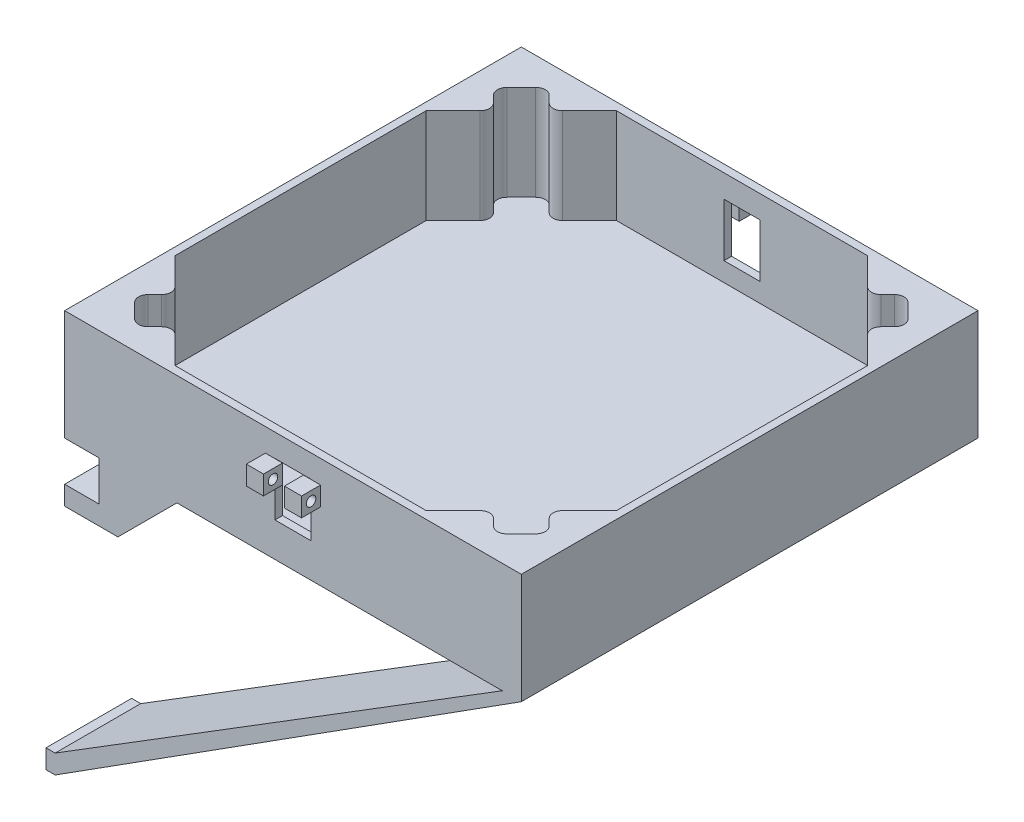
from build123d import *

# Parameters (mm, degrees)
SZKIC1_W                        = 240
SZKIC1_H                        = 240
DODANIE_WYCI_GNI_CIE1_DEPTH     = 8
SZKIC2_W                        = 240
SZKIC2_H                        = 240
SZKIC2_W_2                      = 232
SZKIC2_H_2                      = 232
DODANIE_WYCI_GNI_CIE2_DEPTH     = 50
DODANIE_WYCI_GNI_CIE6_DEPTH     = 50
ZAOKR_GLENIE1_R                 = 5
SZYK_KO_OWY1_COUNT              = 4
ZAOKR_GLENIE1_OF_SZYK_KO_OWY1_R = 5
SZKIC12_W                       = 19
SZKIC12_H                       = 28
WYTNIJ_WYCI_GNI_CIE3_DEPTH      = 275.525044395
DODANIE_WYCI_GNI_CIE7_DEPTH     = 10
SZKIC16_R                       = 2.5
WYTNIJ_WYCI_GNI_CIE4_DEPTH      = 196.842411137
SZKIC5_W                        = 10
SZKIC5_H                        = 240
DODANIE_WYCI_GNI_CIE3_DEPTH     = 21
SZKIC6_W                        = 28
SZKIC6_H                        = 240
DODANIE_WYCI_GNI_CIE4_DEPTH     = 10
SFAZOWANIE2_SIZE                = 31
WYTNIJ_WYCI_GNI_CIE2_DEPTH      = 319.144010562
WYTNIJ_WYCI_GNI_CIE2_DEPTH_BACK = 319.144010562
SZKIC9_W                        = 150
SZKIC9_H                        = 155.854455748
SZKIC10_W                       = 45
SZKIC10_H                       = 10
DODANIE_WYCI_GNI_CIE5_DEPTH     = 4.8


with BuildPart() as part:
    # Szkic1 → Dodanie-wyciągnięcie1 (new body)
    with BuildSketch(Plane(origin=(0, 0, 0), x_dir=(1, 0, 0), z_dir=(0, 1, 0))):
        Rectangle(SZKIC1_W, SZKIC1_H)
    extrude(amount=DODANIE_WYCI_GNI_CIE1_DEPTH)

    # Szkic2 → Dodanie-wyciągnięcie2 (add)
    with BuildSketch(Plane(origin=(0, 8, 0), x_dir=(1, 0, 0), z_dir=(0, 1, 0))):
        Rectangle(SZKIC2_W, SZKIC2_H)
        Rectangle(SZKIC2_W_2, SZKIC2_H_2, mode=Mode.SUBTRACT)
    extrude(amount=DODANIE_WYCI_GNI_CIE2_DEPTH)

    # Szkic11 → Dodanie-wyciągnięcie6 (add)
    with BuildSketch(Plane(origin=(0, 8, 0), x_dir=(1, 0, 0), z_dir=(0, 1, 0))):
        Polygon((-116, 116), (-66, 116), (-83.67766953, 98.32233047), (-94.284271247, 108.928932188), (-108.928932188, 94.284271247), (-98.32233047, 83.67766953), (-116, 66), align=None)
    dodanie_wyci_gni_cie6 = extrude(amount=DODANIE_WYCI_GNI_CIE6_DEPTH)

    # Zaokrąglenie1
    zaokr_glenie1_edges = [part.edges().sort_by_distance(p)[0] for p in [
        (-98.32233047, 33, -83.67766953),
        (-108.928932188, 33, -94.284271247),
        (-94.284271247, 33, -108.928932188),
        (-83.67766953, 33, -98.32233047),
    ]]
    fillet(zaokr_glenie1_edges, radius=ZAOKR_GLENIE1_R)

    # Szyk kołowy1: Dodanie-wyciągnięcie6 ×4 about axis
    szyk_ko_owy1_axis = Axis((0, 0, 0), (0, 1, 0))
    for i in range(1, SZYK_KO_OWY1_COUNT):
        add(dodanie_wyci_gni_cie6.rotate(szyk_ko_owy1_axis, i * 360 / SZYK_KO_OWY1_COUNT))

    # Zaokrąglenie1 of Szyk kołowy1
    zaokr_glenie1_of_szyk_ko_owy1_edges = [part.edges().sort_by_distance(p)[0] for p in [
        (-83.67766953, 33, 98.32233047),
        (-94.284271247, 33, 108.928932188),
        (-108.928932188, 33, 94.284271247),
        (-98.32233047, 33, 83.67766953),
        (98.32233047, 33, 83.67766953),
        (108.928932188, 33, 94.284271247),
        (94.284271247, 33, 108.928932188),
        (83.67766953, 33, 98.32233047),
        (83.67766953, 33, -98.32233047),
        (94.284271247, 33, -108.928932188),
        (108.928932188, 33, -94.284271247),
        (98.32233047, 33, -83.67766953),
    ]]
    fillet(zaokr_glenie1_of_szyk_ko_owy1_edges, radius=ZAOKR_GLENIE1_OF_SZYK_KO_OWY1_R)

    # Szkic12 → Wytnij-wyciągnięcie3 (cut, through all)
    with BuildSketch(Plane(origin=(0, 0, -120), x_dir=(-1, 0, 0), z_dir=(0, 0, -1))):
        with Locations((0, 32)):
            Rectangle(SZKIC12_W, SZKIC12_H)
    extrude(amount=-WYTNIJ_WYCI_GNI_CIE3_DEPTH, mode=Mode.SUBTRACT)

    # Szkic15 → Dodanie-wyciągnięcie7 (add)
    with BuildSketch(Plane.XY.offset(120)):
        Polygon((9.5, 45.9), (14.5, 45.9), (14.5, 35.9), (9.5, 35.9), (5.5, 35.9), (5.5, 45.9), align=None)
        Polygon((-14.5, 45.9), (-14.5, 35.9), (-9.5, 35.9), (-5.5, 35.9), (-5.5, 45.9), (-9.5, 45.9), align=None)
    dodanie_wyci_gni_cie7 = extrude(amount=DODANIE_WYCI_GNI_CIE7_DEPTH)

    # Szkic16 → Wytnij-wyciągnięcie4 (cut, through all)
    with BuildSketch(Plane(origin=(14.5, 0, 0), x_dir=(0, 0, -1), z_dir=(1, 0, 0))):
        with Locations(Location((-125, 41, 0), (0, 0, 90))):
            Circle(SZKIC16_R)
    wytnij_wyci_gni_cie4 = extrude(amount=-WYTNIJ_WYCI_GNI_CIE4_DEPTH, mode=Mode.SUBTRACT)

    # Lustro1: Dodanie-wyciągnięcie7, Wytnij-wyciągnięcie4 across plane
    add(dodanie_wyci_gni_cie7.mirror(Plane.XY))
    add(wytnij_wyci_gni_cie4.mirror(Plane.XY), mode=Mode.SUBTRACT)

    # Szkic5 → Dodanie-wyciągnięcie3 (add)
    with BuildSketch(Plane.XZ):
        with Locations((-97, 0)):
            Rectangle(SZKIC5_W, SZKIC5_H)
    extrude(amount=DODANIE_WYCI_GNI_CIE3_DEPTH)

    # Szkic6 → Dodanie-wyciągnięcie4 (add)
    with BuildSketch(Plane.XZ.offset(21)):
        with Locations((-106, 0)):
            Rectangle(SZKIC6_W, SZKIC6_H)
    extrude(amount=DODANIE_WYCI_GNI_CIE4_DEPTH)

    # Sfazowanie2
    sfazowanie2_edges = [part.edges().sort_by_distance(p)[0] for p in [
        (-92, 0, 0),
    ]]
    chamfer(sfazowanie2_edges, length=SFAZOWANIE2_SIZE - 0.0001)  # a hair under: the kernel refuses the full size

    # Szkic8 → Wyciągnięcie po profilach1 section 0
    with BuildSketch(Plane.ZY.offset(125)):
        with BuildLine():
            Line((-120, -155.854455748), (120, -155.854455748))
            Line((120, -155.854455748), (120, -145.854455748))
            Line((120, -145.854455748), (-120, -145.854455748))
            Line((-120, -145.854455748), (-120, -155.854455748))
        make_face()
    # Szkic7 → Wyciągnięcie po profilach1 section 1
    with BuildSketch(Plane.XZ):
        with BuildLine():
            Line((120, 120), (110, 120))
            Line((110, 120), (110, -120))
            Line((110, -120), (120, -120))
            Line((120, -120), (120, 120))
        make_face()
    loft()

    # Szkic9 → Wytnij-wyciągnięcie2 (cut, two sides: drawn at the far end of the back side and taken through both)
    with BuildSketch(Plane(origin=(120, 0, 0), x_dir=(0, 0, -1), z_dir=(1, 0, 0)).offset(-WYTNIJ_WYCI_GNI_CIE2_DEPTH_BACK)):
        with Locations((0, -77.927227874)):
            Rectangle(SZKIC9_W, SZKIC9_H)
    extrude(amount=WYTNIJ_WYCI_GNI_CIE2_DEPTH + WYTNIJ_WYCI_GNI_CIE2_DEPTH_BACK, mode=Mode.SUBTRACT)

    # Szkic10 → Dodanie-wyciągnięcie5 (add)
    with BuildSketch(Plane.ZY.offset(125)):
        with Locations((97.5, -150.854455748)):
            Rectangle(SZKIC10_W, SZKIC10_H)
        with Locations((-97.5, -150.854455748)):
            Rectangle(SZKIC10_W, SZKIC10_H)
    extrude(amount=DODANIE_WYCI_GNI_CIE5_DEPTH)


solid = part.part
